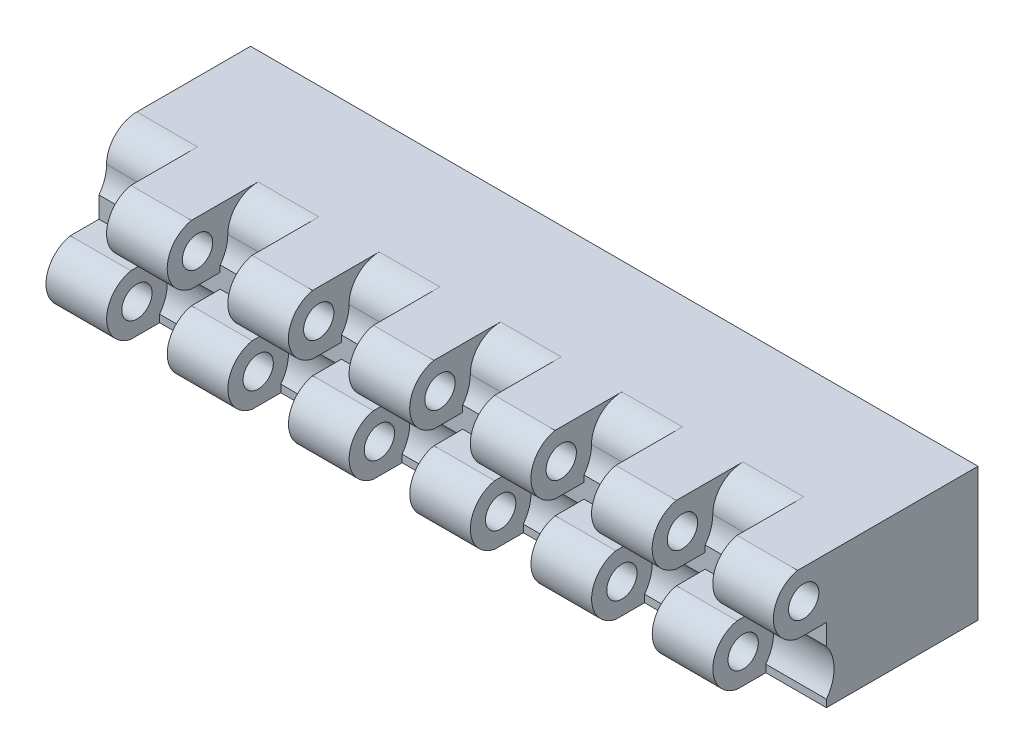
from build123d import *

# Parameters (mm, degrees)
SKETCH1_W           = 25
SKETCH1_H           = 22
BOSS_EXTRUDE1_DEPTH = 60
CUT_EXTRUDE2_REACH  = 123.15
CUT_EXTRUDE3_REACH  = 123.15
SKETCH6_R           = 6.26
FILLET1_R           = 5
SKETCH2_R           = 2.5
BOSS_EXTRUDE2_DEPTH = 10
LPATTERN1_COUNT     = 6
LPATTERN1_PITCH     = 20
SKETCH3_R           = 2.5
BOSS_EXTRUDE3_DEPTH = 10
LPATTERN2_COUNT     = 6
LPATTERN2_PITCH     = 20
SKETCH4_R           = 7
CUT_EXTRUDE1_DEPTH  = 15


with BuildPart() as part:
    # Sketch1 → Boss-Extrude1 (new, symmetric)
    with BuildSketch(Plane(origin=(0, 0, 0), x_dir=(0, 0, -1), z_dir=(1, 0, 0))):
        Rectangle(SKETCH1_W, SKETCH1_H)
    extrude(amount=BOSS_EXTRUDE1_DEPTH, both=True)

    # Sketch5 → Cut-Extrude2 (cut, up to next)
    with BuildSketch(Plane(origin=(60, 0, 0), x_dir=(0, 0, -1), z_dir=(1, 0, 0)), mode=Mode.PRIVATE) as cut_extrude2_sk1:
        with BuildLine():
            Line((-13.743342576, 11), (-11.25, 11))
            Line((-11.25, 11), (-11.25, 6.005))
            ThreePointArc((-11.25, 6.005), (-23.092030441, 3.213639122), (-13.743342576, 11))
        make_face()
    cut_extrude2_tool1 = extrude(cut_extrude2_sk1.sketch, amount=-CUT_EXTRUDE2_REACH, mode=Mode.PRIVATE) & part.part
    add(cut_extrude2_tool1.solids().sort_by_distance((60, 6.117758, 17.335764))[0], mode=Mode.SUBTRACT)

    # Sketch6 → Cut-Extrude3 (cut, up to next)
    with BuildSketch(Plane.ZY.offset(60), mode=Mode.PRIVATE) as cut_extrude3_sk1:
        with Locations((17.5, -6.005)):
            Circle(SKETCH6_R)
    cut_extrude3_tool1 = extrude(cut_extrude3_sk1.sketch, amount=-CUT_EXTRUDE3_REACH, mode=Mode.PRIVATE) & part.part
    add(cut_extrude3_tool1.solids().sort_by_distance((-60, -6.005, 17.5))[0], mode=Mode.SUBTRACT)

    # Fillet1
    fillet1_edges = [part.edges().sort_by_distance(p)[0] for p in [
        (0, 11, 11.25),
    ]]
    fillet(fillet1_edges, radius=FILLET1_R)

    # Sketch2 → Boss-Extrude2 (add)
    with BuildSketch(Plane(origin=(60, 0, 0), x_dir=(0, 0, -1), z_dir=(1, 0, 0))):
        with BuildLine():
            Line((-17.250000617, 1.202041029), (-6.000000617, 1.202041029))
            Line((-6.000000617, 1.202041029), (-6.000000617, 11))
            Line((-6.000000617, 11), (-17.250000617, 11))
            ThreePointArc((-17.250000617, 11), (-21.250000617, 6.101020514), (-17.250000617, 1.202041029))
        make_face()
        with Locations((-16.250000617, 6.101020514)):
            Circle(SKETCH2_R, mode=Mode.SUBTRACT)
    boss_extrude2 = extrude(amount=-BOSS_EXTRUDE2_DEPTH)

    # LPattern1: Boss-Extrude2 ×6
    with Locations(*[(-i * LPATTERN1_PITCH, 0, 0) for i in range(1, LPATTERN1_COUNT)]):
        add(boss_extrude2)

    # Sketch3 → Boss-Extrude3 (add)
    with BuildSketch(Plane.ZY.offset(60)):
        with BuildLine():
            Line((17.24, -1.202041029), (10.99, -1.202041029))
            Line((10.99, -1.202041029), (10.99, -11))
            Line((10.99, -11), (17.24, -11))
            ThreePointArc((17.24, -11), (21.24, -6.101020514), (17.24, -1.202041029))
        make_face()
        with Locations((16.24, -6.101020514)):
            Circle(SKETCH3_R, mode=Mode.SUBTRACT)
    boss_extrude3 = extrude(amount=-BOSS_EXTRUDE3_DEPTH)

    # LPattern2: Boss-Extrude3 ×6
    with Locations(*[(i * LPATTERN2_PITCH, 0, 0) for i in range(1, LPATTERN2_COUNT)]):
        add(boss_extrude3)

    # Sketch4 → Cut-Extrude1 (cut)
    with BuildSketch(Plane(origin=(0, 0, -12.5), x_dir=(-1, 0, 0), z_dir=(0, 0, -1))):
        Circle(SKETCH4_R)
    extrude(amount=-CUT_EXTRUDE1_DEPTH, mode=Mode.SUBTRACT)


solid = part.part
